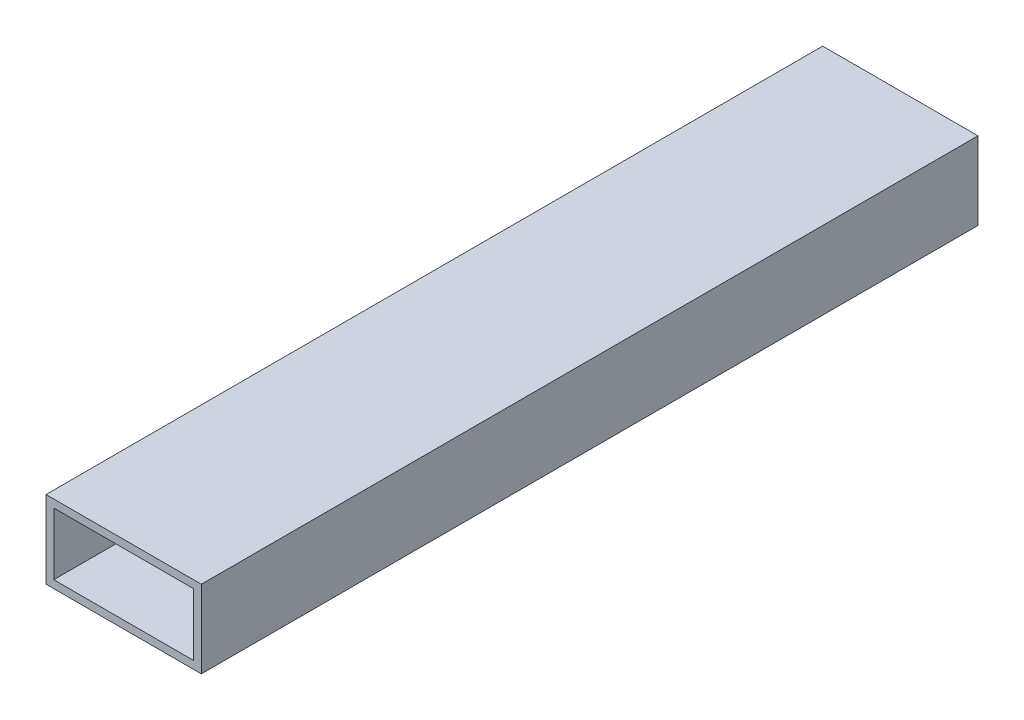
from build123d import *

# Parameters (mm, degrees)
SKETCH1_W           = 25.4
SKETCH1_H           = 12.7
BOSS_EXTRUDE1_DEPTH = 127
SKETCH4_W           = 22.86
SKETCH4_H           = 10.16
CUT_EXTRUDE1_DEPTH  = 128.791284914


with BuildPart() as part:
    # Sketch1 → Boss-Extrude1 (new body)
    with BuildSketch(Plane.XY):
        Rectangle(SKETCH1_W, SKETCH1_H)
    extrude(amount=BOSS_EXTRUDE1_DEPTH)

    # Sketch4 → Cut-Extrude1 (cut, through all)
    with BuildSketch(Plane(origin=(0, 0, 0), x_dir=(-1, 0, 0), z_dir=(0, 0, -1))):
        Rectangle(SKETCH4_W, SKETCH4_H)
    extrude(amount=-CUT_EXTRUDE1_DEPTH, mode=Mode.SUBTRACT)


solid = part.part
